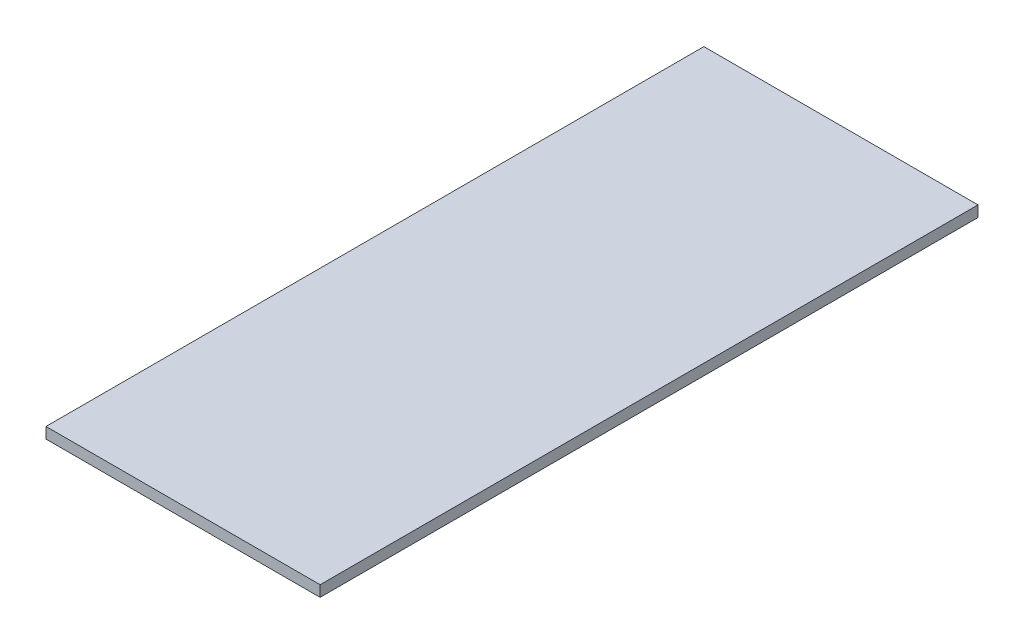
from build123d import *

# Parameters (mm, degrees)
SKETCH1_W          = 60
SKETCH1_H          = 25
BASE_FLANGE1_DEPTH = 1


# Sheet-metal steps are written as plain solids
with BuildPart() as part:
    # Sketch1 → Base-Flange1 (new body)
    with BuildSketch(Plane.ZX):
        Rectangle(SKETCH1_W, SKETCH1_H)
    extrude(amount=-BASE_FLANGE1_DEPTH)


solid = part.part
